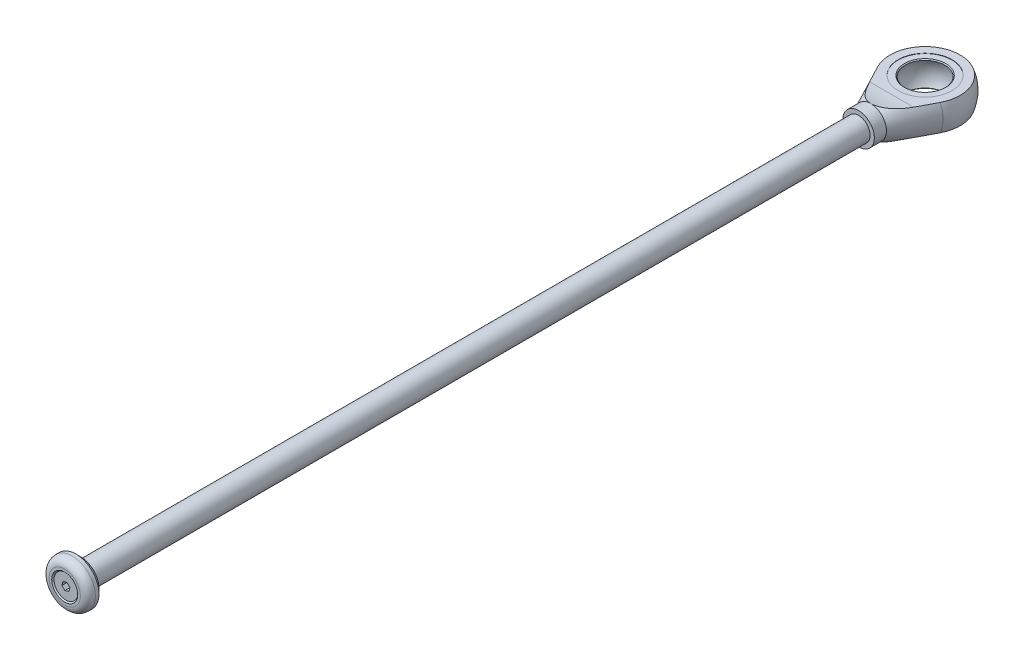
from build123d import *

# Parameters (mm, degrees)
EXTRUDE1_DEPTH      = 2
EXTRUDE2_DEPTH      = 299.063172834
EXTRUDE2_DEPTH_BACK = 299.063172834
SKETCH4_R           = 9.3
EXTRUDE3_DEPTH      = 0.1
CHAMFER1_SIZE       = 0.5


with BuildPart() as part:
    # Sketch1 → Revolve1 (revolve)
    with BuildSketch(Plane(origin=(0, 0, 0), x_dir=(1, 0, 0), z_dir=(0, 1, 0))):
        with BuildLine():
            Line((-11.712232269, -5.525044369), (-5.45, -18.8))
            Line((-5.45, -18.8), (-5.45, -23))
            Line((-5.45, -23), (-4, -23))
            Line((-4, -23), (-4, -292))
            Line((-4, -292), (-6.35, -292))
            Line((-6.35, -292), (-8, -293.65))
            Line((-8, -293.65), (-8, -294.9))
            ThreePointArc((-8, -294.9), (-7.238477631, -296.738477631), (-5.4, -297.5))
            Line((-5.4, -297.5), (-4.5, -297.5))
            Line((-4.5, -297.5), (-4.1, -297.1))
            Line((-4.1, -297.1), (0, -297.1))
            Line((0, -297.1), (0, -8))
            ThreePointArc((0, -8), (-8, 0), (0, 8))
            Line((0, 8), (0, 12.95))
            ThreePointArc((0, 12.95), (-10.937363132, 6.933728269), (-11.712232269, -5.525044369))
        make_face()
    revolve(axis=Axis((0, 0, 0), (0, 0, 1)))

    # Sketch2 → Extrude1 (cut)
    with BuildSketch(Plane.XY.offset(297.1)):
        Polygon((1.38672922, 0.400394061), (0.346613181, 1.401139763), (-1.040116039, 1.000745702), (-1.38672922, -0.400394061), (-0.346613181, -1.401139763), (1.040116039, -1.000745702), align=None)
    extrude(amount=-EXTRUDE1_DEPTH, mode=Mode.SUBTRACT)

    # Sketch3 → Extrude2 (cut, two sides: drawn at the far end of the back side and taken through both)
    with BuildSketch(Plane(origin=(0, 0, 0), x_dir=(0, 0, -1), z_dir=(1, 0, 0)).offset(-EXTRUDE2_DEPTH_BACK)):
        with BuildLine():
            Line((18.703975577, 4.55), (-11.6, 4.55))
            ThreePointArc((-11.6, 4.55), (-15.228015987, 4.775872106), (-18.8, 5.45))
            Line((-18.8, 5.45), (-23, 5.45))
            Line((-23, 5.45), (-23, 17.731418952))
            Line((-23, 17.731418952), (18.703975577, 17.731418952))
            Line((18.703975577, 17.731418952), (18.703975577, 4.55))
        make_face()
        with BuildLine():
            Line((18.703975577, -17.731418952), (18.703975577, -4.55))
            Line((18.703975577, -4.55), (-11.6, -4.55))
            ThreePointArc((-11.6, -4.55), (-15.228015987, -4.775872106), (-18.8, -5.45))
            Line((-18.8, -5.45), (-23, -5.45))
            Line((-23, -5.45), (-23, -17.731418952))
            Line((-23, -17.731418952), (18.703975577, -17.731418952))
        make_face()
    extrude(amount=EXTRUDE2_DEPTH + EXTRUDE2_DEPTH_BACK, mode=Mode.SUBTRACT)

    # Sketch4 → Extrude3 (cut)
    with BuildSketch(Plane(origin=(0, 4.55, 0), x_dir=(1, 0, 0), z_dir=(0, 1, 0))):
        with Locations(Location((0, 0, 0), (0, 0, 270))):
            Circle(SKETCH4_R)
    extrude3 = extrude(amount=-EXTRUDE3_DEPTH, mode=Mode.SUBTRACT)

    # Mirror1: Extrude3 across plane
    add(extrude3.mirror(Plane.ZX), mode=Mode.SUBTRACT)

    # Chamfer1
    # the kernel refuses this chamfer: 0.5, 0.360421404 mm, written as the material it takes off along each edge
    with BuildSketch(Plane(origin=(0, 4.45, 0), x_dir=(0, 0, 1), z_dir=(-1, 0, 0))) as chamfer1_piece_1:
        with BuildLine():
            Line((6.648120035 + CHAMFER1_SIZE, 0), (6.842696069, -0.305423966))
            ThreePointArc((6.842696069, -0.305423966), (6.748300889, -0.153439154), (6.648120035, 0))
            Line((6.648120035, 0), (6.648120035 + CHAMFER1_SIZE, 0))
        make_face()
    revolve(axis=Axis((0, 4.45, 0), (0, 1, 0)), mode=Mode.SUBTRACT)
    with BuildSketch(Plane(origin=(0, -4.45, 0), x_dir=(0, 0, 1), z_dir=(-1, 0, 0))) as chamfer1_piece_2:
        with BuildLine():
            Line((6.648120035 + CHAMFER1_SIZE, 0), (6.842696069, 0.305423966))
            ThreePointArc((6.842696069, 0.305423966), (6.748300889, 0.153439154), (6.648120035, 0))
            Line((6.648120035, 0), (6.648120035 + CHAMFER1_SIZE, 0))
        make_face()
    revolve(axis=Axis((0, -4.45, 0), (0, 1, 0)), mode=Mode.SUBTRACT)


solid = part.part
